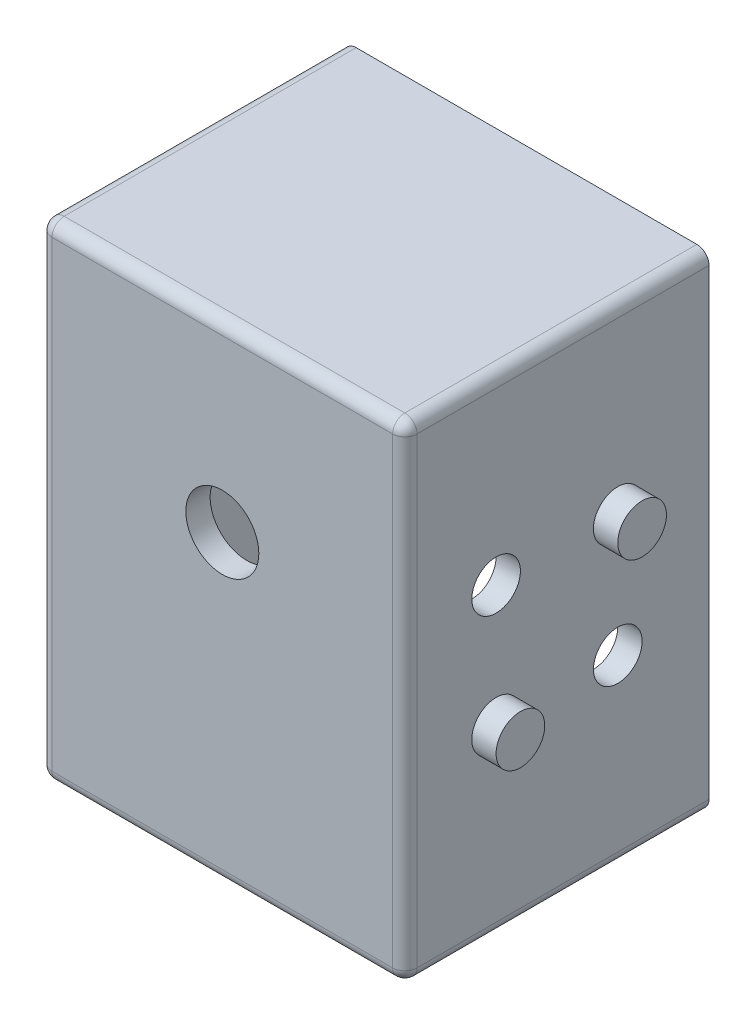
from build123d import *

# Parameters (mm, degrees)
SKETCH2_W           = 30
SKETCH2_H           = 40
BOSS_EXTRUDE2_DEPTH = 25
FILLET2_R           = 1
FILLET3_R           = 1
SHELL1_START        = 2
SHELL1_OUTLINE_W    = 36
SHELL1_OUTLINE_H    = 23
SHELL1_DEPTH        = 26
FILLET4_R           = 1
SKETCH5_R           = 2
CUT_EXTRUDE10_DEPTH = 2
SKETCH7_R           = 2
BOSS_EXTRUDE3_DEPTH = 2
SKETCH4_R           = 3
CUT_EXTRUDE11_DEPTH = 2
SKETCH8_R           = 2
BOSS_EXTRUDE5_DEPTH = 2
SKETCH9_R           = 2
CUT_EXTRUDE12_DEPTH = 2
SKETCH10_R          = 2
CUT_EXTRUDE13_DEPTH = 2
SKETCH11_R          = 2
BOSS_EXTRUDE6_DEPTH = 2


# Read off the part's stored shape, not the designer's step: Shell1
with BuildPart() as part:
    # Sketch2 → Boss-Extrude2 (new body)
    with BuildSketch(Plane.XY):
        with Locations((15, 20)):
            Rectangle(SKETCH2_W, SKETCH2_H)
    extrude(amount=BOSS_EXTRUDE2_DEPTH)

    # Fillet2
    fillet2_edges = [part.edges().sort_by_distance(p)[0] for p in [
        (30, 20, 25),
        (15, 0, 25),
        (0, 20, 25),
        (15, 40, 25),
    ]]
    fillet(fillet2_edges, radius=FILLET2_R)

    # Fillet3
    # the kernel refuses this fillet: 1 mm, written as the material it takes off along each edge
    with BuildSketch(Plane(origin=(1, 39, 24), x_dir=(0, 1, 0), z_dir=(-1, 0, 0))) as fillet3_piece_1_section:
        Polygon((0, 0), (FILLET3_R, 0), (FILLET3_R, -FILLET3_R), (0, -FILLET3_R), align=None)
    fillet3_piece_1 = extrude(amount=FILLET3_R, mode=Mode.PRIVATE)
    fillet3_piece_1 = fillet3_piece_1 - Plane(origin=(1, 39, 24), x_dir=(0, -0.7071067811865475, -0.7071067811865475), z_dir=(-1, 0, 0)) * Sphere(FILLET3_R, mode=Mode.PRIVATE)
    add(fillet3_piece_1, mode=Mode.SUBTRACT)
    with BuildSketch(Plane(origin=(29, 39, 24), x_dir=(0, 1, 0), z_dir=(1, 0, 0))) as fillet3_piece_2_section:
        Polygon((0, 0), (FILLET3_R, 0), (FILLET3_R, FILLET3_R), (0, FILLET3_R), align=None)
    fillet3_piece_2 = extrude(amount=FILLET3_R, mode=Mode.PRIVATE)
    fillet3_piece_2 = fillet3_piece_2 - Plane(origin=(29, 39, 24), x_dir=(0, -0.7071067811865475, -0.7071067811865475), z_dir=(1, 0, 0)) * Sphere(FILLET3_R, mode=Mode.PRIVATE)
    add(fillet3_piece_2, mode=Mode.SUBTRACT)
    with BuildSketch(Plane(origin=(1, 1, 24), x_dir=(-1, 0, 0), z_dir=(0, -1, 0))) as fillet3_piece_3_section:
        Polygon((0, 0), (FILLET3_R, 0), (FILLET3_R, -FILLET3_R), (0, -FILLET3_R), align=None)
    fillet3_piece_3 = extrude(amount=FILLET3_R, mode=Mode.PRIVATE)
    fillet3_piece_3 = fillet3_piece_3 - Plane(origin=(1, 1, 24), x_dir=(0.7071067811865475, 0, -0.7071067811865475), z_dir=(0, -1, 0)) * Sphere(FILLET3_R, mode=Mode.PRIVATE)
    add(fillet3_piece_3, mode=Mode.SUBTRACT)
    with BuildSketch(Plane(origin=(29, 1, 24), x_dir=(1, 0, 0), z_dir=(0, -1, 0))) as fillet3_piece_4_section:
        Polygon((0, 0), (FILLET3_R, 0), (FILLET3_R, FILLET3_R), (0, FILLET3_R), align=None)
    fillet3_piece_4 = extrude(amount=FILLET3_R, mode=Mode.PRIVATE)
    fillet3_piece_4 = fillet3_piece_4 - Plane(origin=(29, 1, 24), x_dir=(-0.7071067811865475, 0, -0.7071067811865475), z_dir=(0, -1, 0)) * Sphere(FILLET3_R, mode=Mode.PRIVATE)
    add(fillet3_piece_4, mode=Mode.SUBTRACT)
    with BuildSketch(Plane(origin=(30, 0, -2.5), x_dir=(-1, 0, 0), z_dir=(0, 0, 1)), Plane(origin=(30, 40, -2.5), x_dir=(0, -1, 0), z_dir=(0, 0, 1))) as fillet3_piece_5:
        with BuildLine():
            CenterArc((FILLET3_R, -FILLET3_R), FILLET3_R, 90, 90)
            Line((0, -FILLET3_R), (0, 0))
            Line((0, 0), (FILLET3_R, 0))
        make_face()
    extrude(amount=26.5, mode=Mode.SUBTRACT)
    with BuildSketch(Plane(origin=(0, 0, -2.5), x_dir=(1, 0, 0), z_dir=(0, 0, 1)), Plane(origin=(0, 40, -2.5), x_dir=(0, -1, 0), z_dir=(0, 0, 1))) as fillet3_piece_6:
        with BuildLine():
            CenterArc((FILLET3_R, FILLET3_R), FILLET3_R, 180, 90)
            Line((0, FILLET3_R), (0, 0))
            Line((0, 0), (FILLET3_R, 0))
        make_face()
    extrude(amount=26.5, mode=Mode.SUBTRACT)

    # Shell1 outline → Shell1 (cut)
    with BuildSketch(Plane.YZ.offset(SHELL1_START)):
        with Locations((20, 11.5)):
            Rectangle(SHELL1_OUTLINE_W, SHELL1_OUTLINE_H)
    extrude(amount=SHELL1_DEPTH, mode=Mode.SUBTRACT)

    # Fillet4
    fillet4_edges = [part.edges().sort_by_distance(p)[0] for p in [
        (28, 20, 23),
        (2, 20, 23),
        (15, 2, 23),
        (15, 38, 23),
    ]]
    fillet(fillet4_edges, radius=FILLET4_R)

    # Sketch5 → Cut-Extrude10 (cut)
    with BuildSketch(Plane.XZ):
        with Locations(Location((20, 17.5, 0), (0, 0, 270))):
            Circle(SKETCH5_R)
        with Locations(Location((10, 7.5, 0), (0, 0, 270))):
            Circle(SKETCH5_R)
    extrude(amount=-CUT_EXTRUDE10_DEPTH, mode=Mode.SUBTRACT)

    # Sketch7 → Boss-Extrude3 (add)
    with BuildSketch(Plane(origin=(0, 0, 0), x_dir=(-1, 0, 0), z_dir=(0, -1, 0))):
        with Locations(Location((-10, -17.5, 0), (0, 0, 270))):
            Circle(SKETCH7_R)
        with Locations(Location((-20, -7.5, 0), (0, 0, 270))):
            Circle(SKETCH7_R)
    extrude(amount=BOSS_EXTRUDE3_DEPTH)

    # Sketch4 → Cut-Extrude11 (cut)
    with BuildSketch(Plane.XY.offset(25)):
        with Locations((15, 25)):
            Circle(SKETCH4_R)
    extrude(amount=-CUT_EXTRUDE11_DEPTH, mode=Mode.SUBTRACT)

    # Sketch8 → Boss-Extrude5 (add)
    with BuildSketch(Plane(origin=(30, 0, 0), x_dir=(0, 0, -1), z_dir=(1, 0, 0))):
        with Locations(Location((-7.5, 25, 0), (0, 0, 270))):
            Circle(SKETCH8_R)
        with Locations(Location((-17.5, 15, 0), (0, 0, 270))):
            Circle(SKETCH8_R)
    extrude(amount=BOSS_EXTRUDE5_DEPTH)

    # Sketch9 → Cut-Extrude12 (cut)
    with BuildSketch(Plane(origin=(30, 0, 0), x_dir=(0, 0, -1), z_dir=(1, 0, 0))):
        with Locations(Location((-7.5, 15, 0), (0, 0, 90))):
            Circle(SKETCH9_R)
        with Locations(Location((-17.5, 25, 0), (0, 0, 90))):
            Circle(SKETCH9_R)
    extrude(amount=-CUT_EXTRUDE12_DEPTH, mode=Mode.SUBTRACT)

    # Sketch10 → Cut-Extrude13 (cut)
    with BuildSketch(Plane.ZY):
        with Locations(Location((7.5, 25, 0), (0, 0, 270))):
            Circle(SKETCH10_R)
        with Locations(Location((16.5, 15, 0), (0, 0, 270))):
            Circle(SKETCH10_R)
    extrude(amount=-CUT_EXTRUDE13_DEPTH, mode=Mode.SUBTRACT)

    # Sketch11 → Boss-Extrude6 (add)
    with BuildSketch(Plane.ZY):
        with Locations(Location((16.5, 25, 0), (0, 0, 270))):
            Circle(SKETCH11_R)
        with Locations(Location((7.5, 15, 0), (0, 0, 90))):
            Circle(SKETCH11_R)
    extrude(amount=BOSS_EXTRUDE6_DEPTH)


solid = part.part
